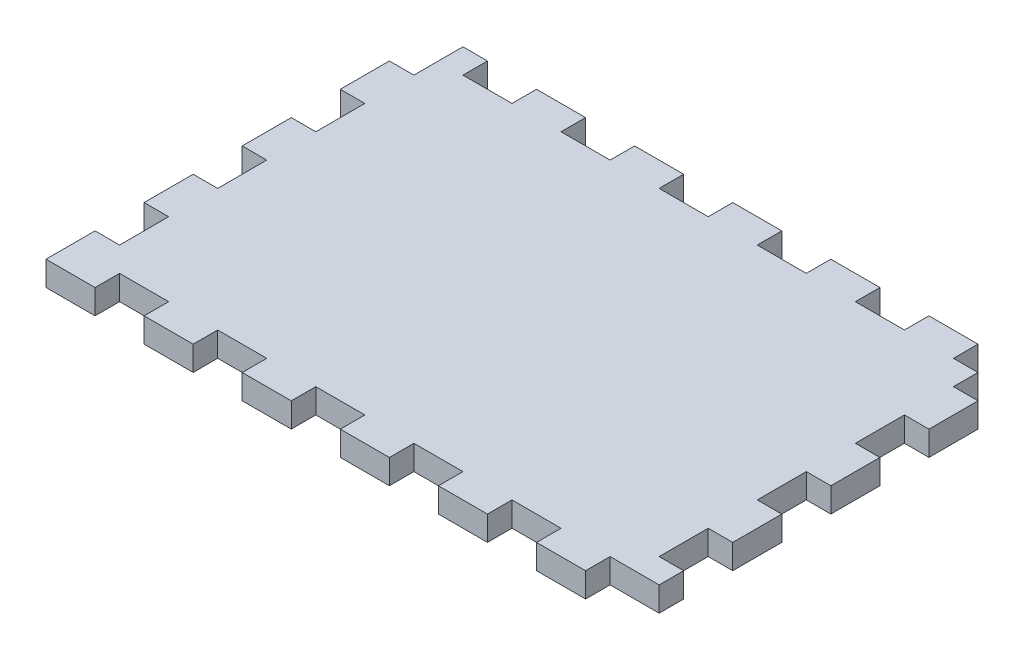
from build123d import *

# Parameters (mm, degrees)
SKETCH1_W           = 152.4
SKETCH1_H           = 101.6
BOSS_EXTRUDE2_DEPTH = 6.35
SKETCH2_W           = 6.35
SKETCH2_H           = 12.7
CUT_EXTRUDE2_DEPTH  = 6.35
SKETCH2_4_W         = 12.7
SKETCH2_4_H         = 6.35
CUT_EXTRUDE3_DEPTH  = 6.35


with BuildPart() as part:
    # Sketch1 → Boss-Extrude2 (new body)
    with BuildSketch(Plane(origin=(0, 0, 0), x_dir=(1, 0, 0), z_dir=(0, 1, 0))):
        with Locations((76.2, 50.8)):
            Rectangle(SKETCH1_W, SKETCH1_H)
    extrude(amount=BOSS_EXTRUDE2_DEPTH)

    # Sketch2 → Cut-Extrude2 (cut)
    with BuildSketch(Plane(origin=(0, 6.35, 0), x_dir=(1, 0, 0), z_dir=(0, 1, 0))):
        with Locations((3.175, 95.25)):
            Rectangle(SKETCH2_W, SKETCH2_H)
        with Locations((3.175, 69.85)):
            Rectangle(SKETCH2_W, SKETCH2_H)
        with Locations((3.175, 44.45)):
            Rectangle(SKETCH2_W, SKETCH2_H)
        with Locations((3.175, 19.05)):
            Rectangle(SKETCH2_W, SKETCH2_H)
    cut_extrude2 = extrude(amount=-CUT_EXTRUDE2_DEPTH, mode=Mode.SUBTRACT)

    # Mirror1: Cut-Extrude2 across plane
    add(cut_extrude2.mirror(Plane.ZY.offset(-76.2)), mode=Mode.SUBTRACT)

    # Sketch2<4> → Cut-Extrude3 (cut)
    with BuildSketch(Plane(origin=(0, 6.35, 0), x_dir=(1, 0, 0), z_dir=(0, 1, 0))):
        with Locations((19.05, 98.425)):
            Rectangle(SKETCH2_4_W, SKETCH2_4_H)
        with Locations((44.45, 98.425)):
            Rectangle(SKETCH2_4_W, SKETCH2_4_H)
        with Locations((69.85, 98.425)):
            Rectangle(SKETCH2_4_W, SKETCH2_4_H)
        with Locations((95.25, 98.425)):
            Rectangle(SKETCH2_4_W, SKETCH2_4_H)
        with Locations((146.05, 98.425)):
            Rectangle(SKETCH2_4_W, SKETCH2_4_H)
        with Locations((120.65, 98.425)):
            Rectangle(SKETCH2_4_W, SKETCH2_4_H)
    cut_extrude3 = extrude(amount=-CUT_EXTRUDE3_DEPTH, mode=Mode.SUBTRACT)

    # Mirror2: Cut-Extrude3 across plane
    add(cut_extrude3.mirror(Plane(origin=(0, 0, -50.8), x_dir=(1, 0, 0), z_dir=(0, 0, -1))), mode=Mode.SUBTRACT)


solid = part.part
